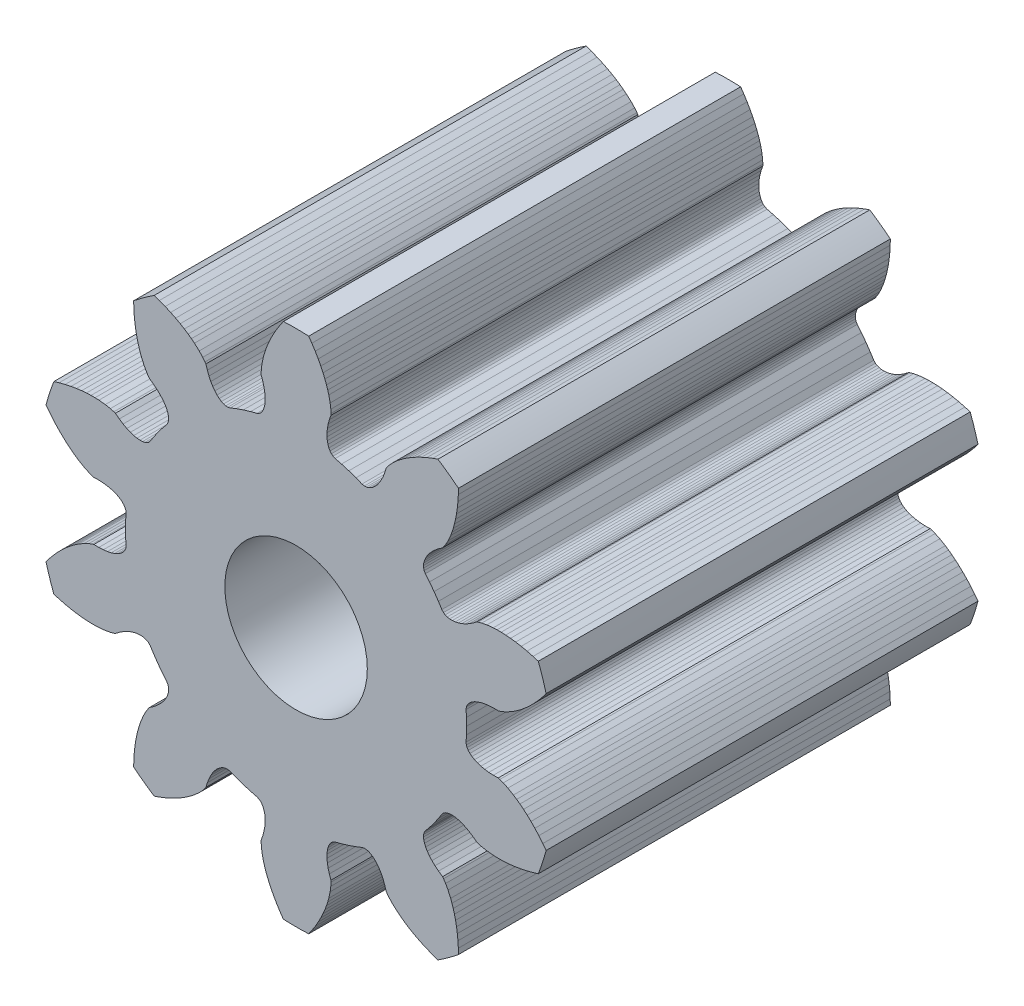
from build123d import *

# Parameters (mm, degrees)
BOSS_EXTRUDE1_DEPTH = 10
SKETCH3_R           = 1.65
CUT_EXTRUDE1_DEPTH  = 10


with BuildPart() as part:
    # Sketch1 → Boss-Extrude1 (new body)
    with BuildSketch(Plane.XY):
        with BuildLine():
            Line((11.24280794, -4.548480945), (11.251725245, -4.403945659))
            Line((11.251725245, -4.403945659), (11.265967937, -4.266876134))
            Line((11.265967937, -4.266876134), (11.28465844, -4.139331217))
            Line((11.28465844, -4.139331217), (11.307131739, -4.02085472))
            Line((11.307131739, -4.02085472), (11.33251264, -3.912045516))
            Line((11.33251264, -3.912045516), (11.360817047, -3.810271492))
            Line((11.360817047, -3.810271492), (11.389663856, -3.721119162))
            Line((11.389663856, -3.721119162), (11.420794724, -3.637118149))
            Line((11.420794724, -3.637118149), (11.480739848, -3.501552594))
            Line((11.480739848, -3.501552594), (11.537697551, -3.397143289))
            Line((11.537697551, -3.397143289), (11.584524134, -3.326188015))
            Line((11.584524134, -3.326188015), (11.607563025, -3.296396327))
            Line((11.607563025, -3.296396327), (11.7007486, -3.231659644))
            Line((11.7007486, -3.231659644), (11.782650219, -3.165257429))
            Line((11.782650219, -3.165257429), (11.853301177, -3.098018273))
            Line((11.853301177, -3.098018273), (11.912793041, -3.030765714))
            Line((11.912793041, -3.030765714), (11.961247519, -2.964313745))
            Line((11.961247519, -2.964313745), (11.998868536, -2.899453414))
            Line((11.998868536, -2.899453414), (12.025888121, -2.83698045))
            Line((12.025888121, -2.83698045), (12.042580832, -2.777647013))
            Line((12.042580832, -2.777647013), (12.049269124, -2.722220173))
            Line((12.049269124, -2.722220173), (12.046326022, -2.67141764))
            Line((12.046326022, -2.67141764), (12.034157218, -2.625933625))
            Line((12.034157218, -2.625933625), (12.00667002, -2.577586728))
            Line((12.00667002, -2.577586728), (11.910885731, -2.461743241))
            Line((11.910885731, -2.461743241), (11.804350933, -2.321745644))
            Line((11.804350933, -2.321745644), (11.704126389, -2.177163381))
            Line((11.704126389, -2.177163381), (11.623551619, -2.050269527))
            Line((11.623551619, -2.050269527), (11.586065014, -2.009187622))
            Line((11.586065014, -2.009187622), (11.546567534, -1.983559035))
            Line((11.546567534, -1.983559035), (11.499160923, -1.965061131))
            Line((11.499160923, -1.965061131), (11.44438007, -1.95429424))
            Line((11.44438007, -1.95429424), (11.382792286, -1.951834936))
            Line((11.382792286, -1.951834936), (11.31502745, -1.95822683))
            Line((11.31502745, -1.95822683), (11.241716085, -1.973963644))
            Line((11.241716085, -1.973963644), (11.163543256, -1.999511821))
            Line((11.163543256, -1.999511821), (11.081198256, -2.035309721))
            Line((11.081198256, -2.035309721), (10.995417706, -2.081724794))
            Line((10.995417706, -2.081724794), (10.906956444, -2.139098434))
            Line((10.906956444, -2.139098434), (10.816592256, -2.207718425))
            Line((10.816592256, -2.207718425), (10.781139283, -2.220423615))
            Line((10.781139283, -2.220423615), (10.699186612, -2.243032007))
            Line((10.699186612, -2.243032007), (10.582286557, -2.264937718))
            Line((10.582286557, -2.264937718), (10.434831987, -2.280056825))
            Line((10.434831987, -2.280056825), (10.34532231, -2.28370632))
            Line((10.34532231, -2.28370632), (10.251619251, -2.28359172))
            Line((10.251619251, -2.28359172), (10.146079859, -2.27906092))
            Line((10.146079859, -2.27906092), (10.034753033, -2.269575618))
            Line((10.034753033, -2.269575618), (9.915130561, -2.254337721))
            Line((9.915130561, -2.254337721), (9.788052434, -2.232700017))
            Line((9.788052434, -2.232700017), (9.653290353, -2.203888721))
            Line((9.653290353, -2.203888721), (9.513073524, -2.167705739))
            Line((9.513073524, -2.167705739), (9.391215367, -2.131083096))
            ThreePointArc((9.391215367, -2.131083096), (9.29365386, -1.854080715), (9.209763553, -1.572636258))
            Line((9.209763553, -1.572636258), (9.286815111, -1.471375772))
            Line((9.286815111, -1.471375772), (9.378985116, -1.359685766))
            Line((9.378985116, -1.359685766), (9.471075093, -1.257165792))
            Line((9.471075093, -1.257165792), (9.561165073, -1.164965812))
            Line((9.561165073, -1.164965812), (9.648985095, -1.082325791))
            Line((9.648985095, -1.082325791), (9.733475098, -1.009215789))
            Line((9.733475098, -1.009215789), (9.81619511, -0.94351578))
            Line((9.81619511, -0.94351578), (9.891935109, -0.88834578))
            Line((9.891935109, -0.88834578), (9.966495071, -0.838685805))
            Line((9.966495071, -0.838685805), (10.094675105, -0.764245785))
            Line((10.094675105, -0.764245785), (10.202125106, -0.713255785))
            Line((10.202125106, -0.713255785), (10.281715091, -0.683375791))
            Line((10.281715091, -0.683375791), (10.317865079, -0.672815794))
            Line((10.317865079, -0.672815794), (10.431305062, -0.675215794))
            Line((10.431305062, -0.675215794), (10.536595103, -0.669635792))
            Line((10.536595103, -0.669635792), (10.633275117, -0.65676579))
            Line((10.633275117, -0.65676579), (10.720935113, -0.637325791))
            Line((10.720935113, -0.637325791), (10.799195082, -0.612045801))
            Line((10.799195082, -0.612045801), (10.867755084, -0.5816858))
            Line((10.867755084, -0.5816858), (10.926335067, -0.54702581))
            Line((10.926335067, -0.54702581), (10.974715085, -0.508835796))
            Line((10.974715085, -0.508835796), (11.012705082, -0.467925798))
            Line((11.012705082, -0.467925798), (11.040185082, -0.425095799))
            Line((11.040185082, -0.425095799), (11.057075085, -0.381145791))
            Line((11.057075085, -0.381145791), (11.063255088, -0.325875762))
            Line((11.063255088, -0.325875762), (11.053855092, -0.175855818))
            Line((11.053855092, -0.175855818), (11.049955091, 2.4198e-05))
            Line((11.049955091, 2.4198e-05), (11.053855092, 0.175904215))
            Line((11.053855092, 0.175904215), (11.063255088, 0.325924159))
            Line((11.063255088, 0.325924159), (11.057075085, 0.381194188))
            Line((11.057075085, 0.381194188), (11.040185082, 0.425144195))
            Line((11.040185082, 0.425144195), (11.012705082, 0.467974195))
            Line((11.012705082, 0.467974195), (10.974715085, 0.508884192))
            Line((10.974715085, 0.508884192), (10.926335067, 0.547074206))
            Line((10.926335067, 0.547074206), (10.867755084, 0.581734196))
            Line((10.867755084, 0.581734196), (10.799195082, 0.612094197))
            Line((10.799195082, 0.612094197), (10.720935113, 0.637374187))
            Line((10.720935113, 0.637374187), (10.633275117, 0.656814186))
            Line((10.633275117, 0.656814186), (10.536595103, 0.669684188))
            Line((10.536595103, 0.669684188), (10.431305062, 0.67526419))
            Line((10.431305062, 0.67526419), (10.317865079, 0.672864191))
            Line((10.317865079, 0.672864191), (10.281715091, 0.683424187))
            Line((10.281715091, 0.683424187), (10.202125106, 0.713304181))
            Line((10.202125106, 0.713304181), (10.094675105, 0.764294182))
            Line((10.094675105, 0.764294182), (9.966495071, 0.838734202))
            Line((9.966495071, 0.838734202), (9.891935109, 0.888394177))
            Line((9.891935109, 0.888394177), (9.81619511, 0.943564176))
            Line((9.81619511, 0.943564176), (9.733475098, 1.009264185))
            Line((9.733475098, 1.009264185), (9.648985095, 1.082374188))
            Line((9.648985095, 1.082374188), (9.561165073, 1.165014209))
            Line((9.561165073, 1.165014209), (9.471075093, 1.257214188))
            Line((9.471075093, 1.257214188), (9.378985116, 1.359734163))
            Line((9.378985116, 1.359734163), (9.286815111, 1.471424169))
            Line((9.286815111, 1.471424169), (9.209756475, 1.572679268))
            ThreePointArc((9.209756475, 1.572679268), (9.293642212, 1.854113936), (9.391198182, 2.131106937))
            Line((9.391198182, 2.131106937), (9.51305364, 2.167738561))
            Line((9.51305364, 2.167738561), (9.653270469, 2.203921543))
            Line((9.653270469, 2.203921543), (9.788032549, 2.232732839))
            Line((9.788032549, 2.232732839), (9.915110676, 2.254370543))
            Line((9.915110676, 2.254370543), (10.034733149, 2.26960844))
            Line((10.034733149, 2.26960844), (10.146059975, 2.279093742))
            Line((10.146059975, 2.279093742), (10.251599367, 2.283624542))
            Line((10.251599367, 2.283624542), (10.345302425, 2.283739142))
            Line((10.345302425, 2.283739142), (10.434812103, 2.280089647))
            Line((10.434812103, 2.280089647), (10.582266673, 2.26497054))
            Line((10.582266673, 2.26497054), (10.699166728, 2.243064829))
            Line((10.699166728, 2.243064829), (10.781119399, 2.220456437))
            Line((10.781119399, 2.220456437), (10.816572372, 2.207751247))
            Line((10.816572372, 2.207751247), (10.90693656, 2.139131256))
            Line((10.90693656, 2.139131256), (10.995397821, 2.081757616))
            Line((10.995397821, 2.081757616), (11.081178372, 2.035342543))
            Line((11.081178372, 2.035342543), (11.163523371, 1.999544643))
            Line((11.163523371, 1.999544643), (11.241696201, 1.973996466))
            Line((11.241696201, 1.973996466), (11.315007566, 1.958259652))
            Line((11.315007566, 1.958259652), (11.382772401, 1.951867758))
            Line((11.382772401, 1.951867758), (11.444360185, 1.954327062))
            Line((11.444360185, 1.954327062), (11.499141039, 1.965093953))
            Line((11.499141039, 1.965093953), (11.54654765, 1.983591857))
            Line((11.54654765, 1.983591857), (11.58604513, 2.009220444))
            Line((11.58604513, 2.009220444), (11.623531735, 2.050302349))
            Line((11.623531735, 2.050302349), (11.704106505, 2.177196202))
            Line((11.704106505, 2.177196202), (11.804331049, 2.321778466))
            Line((11.804331049, 2.321778466), (11.910865847, 2.461776063))
            Line((11.910865847, 2.461776063), (12.006650136, 2.57761955))
            Line((12.006650136, 2.57761955), (12.034137334, 2.625966447))
            Line((12.034137334, 2.625966447), (12.046306138, 2.671450462))
            Line((12.046306138, 2.671450462), (12.04924924, 2.722252995))
            Line((12.04924924, 2.722252995), (12.042560947, 2.777679835))
            Line((12.042560947, 2.777679835), (12.025868237, 2.837013272))
            Line((12.025868237, 2.837013272), (11.998848652, 2.899486236))
            Line((11.998848652, 2.899486236), (11.961227634, 2.964346567))
            Line((11.961227634, 2.964346567), (11.912773157, 3.030798536))
            Line((11.912773157, 3.030798536), (11.853281293, 3.098051095))
            Line((11.853281293, 3.098051095), (11.782630335, 3.165290251))
            Line((11.782630335, 3.165290251), (11.700728716, 3.231692466))
            Line((11.700728716, 3.231692466), (11.60754314, 3.296429149))
            Line((11.60754314, 3.296429149), (11.58450425, 3.326220837))
            Line((11.58450425, 3.326220837), (11.537677667, 3.397176111))
            Line((11.537677667, 3.397176111), (11.480719964, 3.501585416))
            Line((11.480719964, 3.501585416), (11.42077484, 3.637150971))
            Line((11.42077484, 3.637150971), (11.389643972, 3.721151984))
            Line((11.389643972, 3.721151984), (11.360797162, 3.810304314))
            Line((11.360797162, 3.810304314), (11.332492756, 3.912078338))
            Line((11.332492756, 3.912078338), (11.307111855, 4.020887542))
            Line((11.307111855, 4.020887542), (11.284638555, 4.139364039))
            Line((11.284638555, 4.139364039), (11.265948053, 4.266908956))
            Line((11.265948053, 4.266908956), (11.251705361, 4.403978481))
            Line((11.251705361, 4.403978481), (11.242788055, 4.548513767))
            Line((11.242788055, 4.548513767), (11.239945539, 4.675724414))
            ThreePointArc((11.239945539, 4.675724414), (11.473253394, 4.854119255), (11.715011432, 5.020883537))
            Line((11.715011432, 5.020883537), (11.835126141, 4.978894429))
            Line((11.835126141, 4.978894429), (11.969831737, 4.925749631))
            Line((11.969831737, 4.925749631), (12.095791424, 4.869847337))
            Line((12.095791424, 4.869847337), (12.211318145, 4.812658026))
            Line((12.211318145, 4.812658026), (12.317051325, 4.754673337))
            Line((12.317051325, 4.754673337), (12.412691934, 4.696910832))
            Line((12.412691934, 4.696910832), (12.500738235, 4.638541831))
            Line((12.500738235, 4.638541831), (12.576612982, 4.583557297))
            Line((12.576612982, 4.583557297), (12.646882726, 4.527992341))
            Line((12.646882726, 4.527992341), (12.757289225, 4.429089142))
            Line((12.757289225, 4.429089142), (12.838987421, 4.342654846))
            Line((12.838987421, 4.342654846), (12.891999653, 4.276193707))
            Line((12.891999653, 4.276193707), (12.913213808, 4.245076272))
            Line((12.913213808, 4.245076272), (12.945986105, 4.136446782))
            Line((12.945986105, 4.136446782), (12.983829429, 4.038034322))
            Line((12.983829429, 4.038034322), (13.025945325, 3.950063229))
            Line((13.025945325, 3.950063229), (13.071522251, 3.872700884))
            Line((13.071522251, 3.872700884), (13.119748593, 3.806083165))
            Line((13.119748593, 3.806083165), (13.169808925, 3.750260529))
            Line((13.169808925, 3.750260529), (13.22087471, 3.705258142))
            Line((13.22087471, 3.705258142), (13.272145802, 3.671047347))
            Line((13.272145802, 3.671047347), (13.322793101, 3.647558648))
            Line((13.322793101, 3.647558648), (13.372018644, 3.634658837))
            Line((13.372018644, 3.634658837), (13.41903688, 3.63217674))
            Line((13.41903688, 3.63217674), (13.473511535, 3.643378551))
            Line((13.473511535, 3.643378551), (13.613284203, 3.698677239))
            Line((13.613284203, 3.698677239), (13.779350886, 3.756736233))
            Line((13.779350886, 3.756736233), (13.947827886, 3.807377033))
            Line((13.947827886, 3.807377033), (14.093410086, 3.844795833))
            Line((14.093410086, 3.844795833), (14.144065286, 3.867752733))
            Line((14.144065286, 3.867752733), (14.180644886, 3.897397433))
            Line((14.180644886, 3.897397433), (14.212886886, 3.936767633))
            Line((14.212886886, 3.936767633), (14.240055086, 3.985540133))
            Line((14.240055086, 3.985540133), (14.261425686, 4.043353633))
            Line((14.261425686, 4.043353633), (14.276287086, 4.109777033))
            Line((14.276287086, 4.109777033), (14.283974886, 4.184363233))
            Line((14.283974886, 4.184363233), (14.283833986, 4.266604833))
            Line((14.283833986, 4.266604833), (14.275234086, 4.355981733))
            Line((14.275234086, 4.355981733), (14.257598386, 4.451906933))
            Line((14.257598386, 4.451906933), (14.230368886, 4.553768033))
            Line((14.230368886, 4.553768033), (14.193031486, 4.660914233))
            Line((14.193031486, 4.660914233), (14.191903686, 4.698558133))
            Line((14.191903686, 4.698558133), (14.195726586, 4.783486133))
            Line((14.195726586, 4.783486133), (14.211017086, 4.901433933))
            Line((14.211017086, 4.901433933), (14.242203886, 5.046343633))
            Line((14.242203886, 5.046343633), (14.266393086, 5.132600133))
            Line((14.266393086, 5.132600133), (14.295457886, 5.221681633))
            Line((14.295457886, 5.221681633), (14.332380486, 5.320655433))
            Line((14.332380486, 5.320655433), (14.375803386, 5.423602433))
            Line((14.375803386, 5.423602433), (14.427260786, 5.532661433))
            Line((14.427260786, 5.532661433), (14.487108886, 5.646833433))
            Line((14.487108886, 5.646833433), (14.556153786, 5.766096633))
            Line((14.556153786, 5.766096633), (14.633895186, 5.888269633))
            Line((14.633895186, 5.888269633), (14.706381822, 5.992846477))
            ThreePointArc((14.706381822, 5.992846477), (14.999974513, 6.000034529), (15.293567239, 5.992847859))
            Line((15.293567239, 5.992847859), (15.366061423, 5.888276248))
            Line((15.366061423, 5.888276248), (15.443802823, 5.766103248))
            Line((15.443802823, 5.766103248), (15.512847723, 5.646840048))
            Line((15.512847723, 5.646840048), (15.572695823, 5.532668048))
            Line((15.572695823, 5.532668048), (15.624153223, 5.423609048))
            Line((15.624153223, 5.423609048), (15.667576123, 5.320662048))
            Line((15.667576123, 5.320662048), (15.704498723, 5.221688248))
            Line((15.704498723, 5.221688248), (15.733563523, 5.132606748))
            Line((15.733563523, 5.132606748), (15.757752723, 5.046350248))
            Line((15.757752723, 5.046350248), (15.788939523, 4.901440548))
            Line((15.788939523, 4.901440548), (15.804230023, 4.783492748))
            Line((15.804230023, 4.783492748), (15.808052923, 4.698564748))
            Line((15.808052923, 4.698564748), (15.806925123, 4.660920848))
            Line((15.806925123, 4.660920848), (15.769587723, 4.553774648))
            Line((15.769587723, 4.553774648), (15.742358223, 4.451913548))
            Line((15.742358223, 4.451913548), (15.724722523, 4.355988348))
            Line((15.724722523, 4.355988348), (15.716122623, 4.266611448))
            Line((15.716122623, 4.266611448), (15.715981723, 4.184369848))
            Line((15.715981723, 4.184369848), (15.723669523, 4.109783648))
            Line((15.723669523, 4.109783648), (15.738530923, 4.043360248))
            Line((15.738530923, 4.043360248), (15.759901523, 3.985546748))
            Line((15.759901523, 3.985546748), (15.787069723, 3.936774248))
            Line((15.787069723, 3.936774248), (15.819311723, 3.897404048))
            Line((15.819311723, 3.897404048), (15.855891323, 3.867759348))
            Line((15.855891323, 3.867759348), (15.906546523, 3.844802448))
            Line((15.906546523, 3.844802448), (16.052128723, 3.807383648))
            Line((16.052128723, 3.807383648), (16.220605723, 3.756742848))
            Line((16.220605723, 3.756742848), (16.386672406, 3.698683854))
            Line((16.386672406, 3.698683854), (16.526445074, 3.643385166))
            Line((16.526445074, 3.643385166), (16.580919729, 3.632183355))
            Line((16.580919729, 3.632183355), (16.627937965, 3.634665452))
            Line((16.627937965, 3.634665452), (16.677163508, 3.647565263))
            Line((16.677163508, 3.647565263), (16.727810807, 3.671053962))
            Line((16.727810807, 3.671053962), (16.779081898, 3.705264757))
            Line((16.779081898, 3.705264757), (16.830147684, 3.750267144))
            Line((16.830147684, 3.750267144), (16.880208016, 3.80608978))
            Line((16.880208016, 3.80608978), (16.928434358, 3.872707499))
            Line((16.928434358, 3.872707499), (16.974011284, 3.950069844))
            Line((16.974011284, 3.950069844), (17.01612718, 4.038040937))
            Line((17.01612718, 4.038040937), (17.053970503, 4.136453396))
            Line((17.053970503, 4.136453396), (17.086742801, 4.245082887))
            Line((17.086742801, 4.245082887), (17.107956956, 4.276200321))
            Line((17.107956956, 4.276200321), (17.160969188, 4.342661461))
            Line((17.160969188, 4.342661461), (17.242667384, 4.429095757))
            Line((17.242667384, 4.429095757), (17.353073883, 4.527998956))
            Line((17.353073883, 4.527998956), (17.423343627, 4.583563912))
            Line((17.423343627, 4.583563912), (17.499218374, 4.638548446))
            Line((17.499218374, 4.638548446), (17.587264675, 4.696917447))
            Line((17.587264675, 4.696917447), (17.682905284, 4.754679952))
            Line((17.682905284, 4.754679952), (17.788638464, 4.812664641))
            Line((17.788638464, 4.812664641), (17.904165185, 4.869853952))
            Line((17.904165185, 4.869853952), (18.030124872, 4.925756246))
            Line((18.030124872, 4.925756246), (18.164830468, 4.978901044))
            Line((18.164830468, 4.978901044), (18.284942048, 5.020899103))
            ThreePointArc((18.284942048, 5.020899103), (18.526688607, 4.85414488), (18.759985941, 4.675761237))
            Line((18.759985941, 4.675761237), (18.757169332, 4.548550014))
            Line((18.757169332, 4.548550014), (18.748252027, 4.404014728))
            Line((18.748252027, 4.404014728), (18.734009334, 4.266945203))
            Line((18.734009334, 4.266945203), (18.715318832, 4.139400286))
            Line((18.715318832, 4.139400286), (18.692845533, 4.020923789))
            Line((18.692845533, 4.020923789), (18.667464632, 3.912114585))
            Line((18.667464632, 3.912114585), (18.639160225, 3.810340561))
            Line((18.639160225, 3.810340561), (18.610313415, 3.721188232))
            Line((18.610313415, 3.721188232), (18.579182547, 3.637187218))
            Line((18.579182547, 3.637187218), (18.519237423, 3.501621663))
            Line((18.519237423, 3.501621663), (18.46227972, 3.397212358))
            Line((18.46227972, 3.397212358), (18.415453138, 3.326257084))
            Line((18.415453138, 3.326257084), (18.392414247, 3.296465396))
            Line((18.392414247, 3.296465396), (18.299228671, 3.231728713))
            Line((18.299228671, 3.231728713), (18.217327053, 3.165326498))
            Line((18.217327053, 3.165326498), (18.146676094, 3.098087343))
            Line((18.146676094, 3.098087343), (18.087184231, 3.030834784))
            Line((18.087184231, 3.030834784), (18.038729753, 2.964382814))
            Line((18.038729753, 2.964382814), (18.001108735, 2.899522483))
            Line((18.001108735, 2.899522483), (17.974089151, 2.837049519))
            Line((17.974089151, 2.837049519), (17.95739644, 2.777716082))
            Line((17.95739644, 2.777716082), (17.950708147, 2.722289242))
            Line((17.950708147, 2.722289242), (17.953651249, 2.671486709))
            Line((17.953651249, 2.671486709), (17.965820053, 2.626002694))
            Line((17.965820053, 2.626002694), (17.993307252, 2.577655797))
            Line((17.993307252, 2.577655797), (18.089091541, 2.46181231))
            Line((18.089091541, 2.46181231), (18.195626338, 2.321814713))
            Line((18.195626338, 2.321814713), (18.295850882, 2.17723245))
            Line((18.295850882, 2.17723245), (18.376425653, 2.050338597))
            Line((18.376425653, 2.050338597), (18.413912258, 2.009256691))
            Line((18.413912258, 2.009256691), (18.453409738, 1.983628104))
            Line((18.453409738, 1.983628104), (18.500816348, 1.9651302))
            Line((18.500816348, 1.9651302), (18.555597202, 1.954363309))
            Line((18.555597202, 1.954363309), (18.617184986, 1.951904006))
            Line((18.617184986, 1.951904006), (18.684949822, 1.9582959))
            Line((18.684949822, 1.9582959), (18.758261186, 1.974032713))
            Line((18.758261186, 1.974032713), (18.836434016, 1.99958089))
            Line((18.836434016, 1.99958089), (18.918779015, 2.03537879))
            Line((18.918779015, 2.03537879), (19.004559566, 2.081793863))
            Line((19.004559566, 2.081793863), (19.093020828, 2.139167503))
            Line((19.093020828, 2.139167503), (19.183385016, 2.207787494))
            Line((19.183385016, 2.207787494), (19.218837988, 2.220492685))
            Line((19.218837988, 2.220492685), (19.30079066, 2.243101077))
            Line((19.30079066, 2.243101077), (19.417690714, 2.265006787))
            Line((19.417690714, 2.265006787), (19.565145285, 2.280125894))
            Line((19.565145285, 2.280125894), (19.654654962, 2.283775389))
            Line((19.654654962, 2.283775389), (19.74835802, 2.283660789))
            Line((19.74835802, 2.283660789), (19.853897413, 2.279129989))
            Line((19.853897413, 2.279129989), (19.965224238, 2.269644687))
            Line((19.965224238, 2.269644687), (20.084846711, 2.254406791))
            Line((20.084846711, 2.254406791), (20.211924838, 2.232769086))
            Line((20.211924838, 2.232769086), (20.346686919, 2.20395779))
            Line((20.346686919, 2.20395779), (20.486903747, 2.167774809))
            Line((20.486903747, 2.167774809), (20.608761905, 2.131152165))
            ThreePointArc((20.608761905, 2.131152165), (20.706323412, 1.854149785), (20.790213719, 1.572705327))
            Line((20.790213719, 1.572705327), (20.713162161, 1.471444842))
            Line((20.713162161, 1.471444842), (20.620992156, 1.359754836))
            Line((20.620992156, 1.359754836), (20.528902179, 1.257234861))
            Line((20.528902179, 1.257234861), (20.438812199, 1.165034882))
            Line((20.438812199, 1.165034882), (20.350992176, 1.08239486))
            Line((20.350992176, 1.08239486), (20.266502173, 1.009284858))
            Line((20.266502173, 1.009284858), (20.183782162, 0.943584849))
            Line((20.183782162, 0.943584849), (20.108042163, 0.88841485))
            Line((20.108042163, 0.88841485), (20.0334822, 0.838754874))
            Line((20.0334822, 0.838754874), (19.905302166, 0.764314855))
            Line((19.905302166, 0.764314855), (19.797852165, 0.713324854))
            Line((19.797852165, 0.713324854), (19.71826218, 0.68344486))
            Line((19.71826218, 0.68344486), (19.682112193, 0.672884863))
            Line((19.682112193, 0.672884863), (19.56867221, 0.675284863))
            Line((19.56867221, 0.675284863), (19.463382168, 0.669704861))
            Line((19.463382168, 0.669704861), (19.366702155, 0.656834859))
            Line((19.366702155, 0.656834859), (19.279042159, 0.63739486))
            Line((19.279042159, 0.63739486), (19.20078219, 0.61211487))
            Line((19.20078219, 0.61211487), (19.132222188, 0.581754869))
            Line((19.132222188, 0.581754869), (19.073642205, 0.547094879))
            Line((19.073642205, 0.547094879), (19.025262187, 0.508904865))
            Line((19.025262187, 0.508904865), (18.987272189, 0.467994867))
            Line((18.987272189, 0.467994867), (18.95979219, 0.425164868))
            Line((18.95979219, 0.425164868), (18.942902187, 0.38121486))
            Line((18.942902187, 0.38121486), (18.936722183, 0.325944831))
            Line((18.936722183, 0.325944831), (18.94612218, 0.175924887))
            Line((18.94612218, 0.175924887), (18.95002218, 4.4871e-05))
            Line((18.95002218, 4.4871e-05), (18.94612218, -0.175835145))
            Line((18.94612218, -0.175835145), (18.936722183, -0.325855089))
            Line((18.936722183, -0.325855089), (18.942902187, -0.381125118))
            Line((18.942902187, -0.381125118), (18.95979219, -0.425075126))
            Line((18.95979219, -0.425075126), (18.987272189, -0.467905125))
            Line((18.987272189, -0.467905125), (19.025262187, -0.508815123))
            Line((19.025262187, -0.508815123), (19.073642205, -0.547005137))
            Line((19.073642205, -0.547005137), (19.132222188, -0.581665127))
            Line((19.132222188, -0.581665127), (19.20078219, -0.612025128))
            Line((19.20078219, -0.612025128), (19.279042159, -0.637305118))
            Line((19.279042159, -0.637305118), (19.366702155, -0.656745117))
            Line((19.366702155, -0.656745117), (19.463382168, -0.669615119))
            Line((19.463382168, -0.669615119), (19.56867221, -0.675195121))
            Line((19.56867221, -0.675195121), (19.682112193, -0.672795121))
            Line((19.682112193, -0.672795121), (19.71826218, -0.683355118))
            Line((19.71826218, -0.683355118), (19.797852165, -0.713235112))
            Line((19.797852165, -0.713235112), (19.905302166, -0.764225113))
            Line((19.905302166, -0.764225113), (20.0334822, -0.838665132))
            Line((20.0334822, -0.838665132), (20.108042163, -0.888325108))
            Line((20.108042163, -0.888325108), (20.183782162, -0.943495107))
            Line((20.183782162, -0.943495107), (20.266502173, -1.009195116))
            Line((20.266502173, -1.009195116), (20.350992176, -1.082305118))
            Line((20.350992176, -1.082305118), (20.438812199, -1.16494514))
            Line((20.438812199, -1.16494514), (20.528902179, -1.257145119))
            Line((20.528902179, -1.257145119), (20.620992156, -1.359665094))
            Line((20.620992156, -1.359665094), (20.713162161, -1.471355099))
            Line((20.713162161, -1.471355099), (20.790220797, -1.572610199))
            ThreePointArc((20.790220797, -1.572610199), (20.706335059, -1.854044867), (20.608779089, -2.131037867))
            Line((20.608779089, -2.131037867), (20.486923632, -2.167669492))
            Line((20.486923632, -2.167669492), (20.346706803, -2.203852474))
            Line((20.346706803, -2.203852474), (20.211944722, -2.23266377))
            Line((20.211944722, -2.23266377), (20.084866595, -2.254301474))
            Line((20.084866595, -2.254301474), (19.965244122, -2.269539371))
            Line((19.965244122, -2.269539371), (19.853917297, -2.279024673))
            Line((19.853917297, -2.279024673), (19.748377905, -2.283555473))
            Line((19.748377905, -2.283555473), (19.654674846, -2.283670073))
            Line((19.654674846, -2.283670073), (19.565165169, -2.280020578))
            Line((19.565165169, -2.280020578), (19.417710599, -2.26490147))
            Line((19.417710599, -2.26490147), (19.300810544, -2.24299576))
            Line((19.300810544, -2.24299576), (19.218857873, -2.220387368))
            Line((19.218857873, -2.220387368), (19.1834049, -2.207682178))
            Line((19.1834049, -2.207682178), (19.093040712, -2.139062187))
            Line((19.093040712, -2.139062187), (19.00457945, -2.081688547))
            Line((19.00457945, -2.081688547), (18.9187989, -2.035273474))
            Line((18.9187989, -2.035273474), (18.8364539, -1.999475574))
            Line((18.8364539, -1.999475574), (18.758281071, -1.973927397))
            Line((18.758281071, -1.973927397), (18.684969706, -1.958190583))
            Line((18.684969706, -1.958190583), (18.61720487, -1.951798689))
            Line((18.61720487, -1.951798689), (18.555617086, -1.954257993))
            Line((18.555617086, -1.954257993), (18.500836233, -1.965024883))
            Line((18.500836233, -1.965024883), (18.453429622, -1.983522788))
            Line((18.453429622, -1.983522788), (18.413932142, -2.009151374))
            Line((18.413932142, -2.009151374), (18.376445537, -2.05023328))
            Line((18.376445537, -2.05023328), (18.295870767, -2.177127133))
            Line((18.295870767, -2.177127133), (18.195646223, -2.321709397))
            Line((18.195646223, -2.321709397), (18.089111425, -2.461706993))
            Line((18.089111425, -2.461706993), (17.993327136, -2.57755048))
            Line((17.993327136, -2.57755048), (17.965839937, -2.625897378))
            Line((17.965839937, -2.625897378), (17.953671134, -2.671381392))
            Line((17.953671134, -2.671381392), (17.950728032, -2.722183925))
            Line((17.950728032, -2.722183925), (17.957416324, -2.777610765))
            Line((17.957416324, -2.777610765), (17.974109035, -2.836944202))
            Line((17.974109035, -2.836944202), (18.00112862, -2.899417167))
            Line((18.00112862, -2.899417167), (18.038749637, -2.964277498))
            Line((18.038749637, -2.964277498), (18.087204115, -3.030729467))
            Line((18.087204115, -3.030729467), (18.146695979, -3.097982026))
            Line((18.146695979, -3.097982026), (18.217346937, -3.165221181))
            Line((18.217346937, -3.165221181), (18.299248556, -3.231623397))
            Line((18.299248556, -3.231623397), (18.392434131, -3.29636008))
            Line((18.392434131, -3.29636008), (18.415473022, -3.326151768))
            Line((18.415473022, -3.326151768), (18.462299605, -3.397107041))
            Line((18.462299605, -3.397107041), (18.519257307, -3.501516347))
            Line((18.519257307, -3.501516347), (18.579202432, -3.637081902))
            Line((18.579202432, -3.637081902), (18.6103333, -3.721082915))
            Line((18.6103333, -3.721082915), (18.639180109, -3.810235244))
            Line((18.639180109, -3.810235244), (18.667484516, -3.912009269))
            Line((18.667484516, -3.912009269), (18.692865417, -4.020818473))
            Line((18.692865417, -4.020818473), (18.715338716, -4.13929497))
            Line((18.715338716, -4.13929497), (18.734029219, -4.266839886))
            Line((18.734029219, -4.266839886), (18.748271911, -4.403909412))
            Line((18.748271911, -4.403909412), (18.757189216, -4.548444698))
            Line((18.757189216, -4.548444698), (18.760031732, -4.675655345))
            ThreePointArc((18.760031732, -4.675655345), (18.526719393, -4.854053443), (18.284956564, -5.020820536))
            Line((18.284956564, -5.020820536), (18.164841855, -4.978831429))
            Line((18.164841855, -4.978831429), (18.030136259, -4.92568663))
            Line((18.030136259, -4.92568663), (17.904176572, -4.869784336))
            Line((17.904176572, -4.869784336), (17.788649851, -4.812595026))
            Line((17.788649851, -4.812595026), (17.682916671, -4.754610337))
            Line((17.682916671, -4.754610337), (17.587276062, -4.696847832))
            Line((17.587276062, -4.696847832), (17.49922976, -4.638478831))
            Line((17.49922976, -4.638478831), (17.423355013, -4.583494296))
            Line((17.423355013, -4.583494296), (17.35308527, -4.527929341))
            Line((17.35308527, -4.527929341), (17.242678771, -4.429026142))
            Line((17.242678771, -4.429026142), (17.160980574, -4.342591846))
            Line((17.160980574, -4.342591846), (17.107968343, -4.276130706))
            Line((17.107968343, -4.276130706), (17.086754187, -4.245013271))
            Line((17.086754187, -4.245013271), (17.05398189, -4.136383781))
            Line((17.05398189, -4.136383781), (17.016138567, -4.037971321))
            Line((17.016138567, -4.037971321), (16.974022671, -3.950000228))
            Line((16.974022671, -3.950000228), (16.928445745, -3.872637884))
            Line((16.928445745, -3.872637884), (16.880219403, -3.806020164))
            Line((16.880219403, -3.806020164), (16.830159071, -3.750197529))
            Line((16.830159071, -3.750197529), (16.779093285, -3.705195142))
            Line((16.779093285, -3.705195142), (16.727822193, -3.670984347))
            Line((16.727822193, -3.670984347), (16.677174895, -3.647495648))
            Line((16.677174895, -3.647495648), (16.627949352, -3.634595836))
            Line((16.627949352, -3.634595836), (16.580931115, -3.63211374))
            Line((16.580931115, -3.63211374), (16.526456461, -3.643315551))
            Line((16.526456461, -3.643315551), (16.386683793, -3.698614238))
            Line((16.386683793, -3.698614238), (16.220617109, -3.756673233))
            Line((16.220617109, -3.756673233), (16.052140109, -3.807314033))
            Line((16.052140109, -3.807314033), (15.906557909, -3.844732833))
            Line((15.906557909, -3.844732833), (15.855902709, -3.867689733))
            Line((15.855902709, -3.867689733), (15.819323109, -3.897334433))
            Line((15.819323109, -3.897334433), (15.787081109, -3.936704633))
            Line((15.787081109, -3.936704633), (15.759912909, -3.985477133))
            Line((15.759912909, -3.985477133), (15.738542309, -4.043290633))
            Line((15.738542309, -4.043290633), (15.723680909, -4.109714033))
            Line((15.723680909, -4.109714033), (15.715993109, -4.184300233))
            Line((15.715993109, -4.184300233), (15.716134009, -4.266541833))
            Line((15.716134009, -4.266541833), (15.724733909, -4.355918733))
            Line((15.724733909, -4.355918733), (15.742369609, -4.451843933))
            Line((15.742369609, -4.451843933), (15.769599109, -4.553705033))
            Line((15.769599109, -4.553705033), (15.806936509, -4.660851233))
            Line((15.806936509, -4.660851233), (15.808064309, -4.698495133))
            Line((15.808064309, -4.698495133), (15.804241409, -4.783423133))
            Line((15.804241409, -4.783423133), (15.788950909, -4.901370933))
            Line((15.788950909, -4.901370933), (15.757764109, -5.046280633))
            Line((15.757764109, -5.046280633), (15.733574909, -5.132537133))
            Line((15.733574909, -5.132537133), (15.704510109, -5.221618633))
            Line((15.704510109, -5.221618633), (15.667587509, -5.320592433))
            Line((15.667587509, -5.320592433), (15.624164609, -5.423539433))
            Line((15.624164609, -5.423539433), (15.572707209, -5.532598433))
            Line((15.572707209, -5.532598433), (15.512859109, -5.646770433))
            Line((15.512859109, -5.646770433), (15.443814209, -5.766033633))
            Line((15.443814209, -5.766033633), (15.366072809, -5.888206633))
            Line((15.366072809, -5.888206633), (15.293578609, -5.992778233))
            ThreePointArc((15.293578609, -5.992778233), (14.999964402, -5.99996546), (14.706350252, -5.992775861))
            Line((14.706350252, -5.992775861), (14.633877797, -5.88818919))
            Line((14.633877797, -5.88818919), (14.556136397, -5.76601619))
            Line((14.556136397, -5.76601619), (14.487091497, -5.64675299))
            Line((14.487091497, -5.64675299), (14.427243397, -5.53258099))
            Line((14.427243397, -5.53258099), (14.375785997, -5.42352199))
            Line((14.375785997, -5.42352199), (14.332363097, -5.32057499))
            Line((14.332363097, -5.32057499), (14.295440497, -5.22160119))
            Line((14.295440497, -5.22160119), (14.266375697, -5.13251969))
            Line((14.266375697, -5.13251969), (14.242186497, -5.04626319))
            Line((14.242186497, -5.04626319), (14.210999697, -4.90135349))
            Line((14.210999697, -4.90135349), (14.195709197, -4.78340569))
            Line((14.195709197, -4.78340569), (14.191886297, -4.69847769))
            Line((14.191886297, -4.69847769), (14.193014097, -4.66083379))
            Line((14.193014097, -4.66083379), (14.230351497, -4.55368759))
            Line((14.230351497, -4.55368759), (14.257580997, -4.45182649))
            Line((14.257580997, -4.45182649), (14.275216697, -4.35590129))
            Line((14.275216697, -4.35590129), (14.283816597, -4.26652439))
            Line((14.283816597, -4.26652439), (14.283957497, -4.18428279))
            Line((14.283957497, -4.18428279), (14.276269697, -4.10969659))
            Line((14.276269697, -4.10969659), (14.261408297, -4.04327319))
            Line((14.261408297, -4.04327319), (14.240037697, -3.98545969))
            Line((14.240037697, -3.98545969), (14.212869497, -3.93668719))
            Line((14.212869497, -3.93668719), (14.180627497, -3.89731699))
            Line((14.180627497, -3.89731699), (14.144047897, -3.86767229))
            Line((14.144047897, -3.86767229), (14.093392697, -3.84471539))
            Line((14.093392697, -3.84471539), (13.947810497, -3.80729659))
            Line((13.947810497, -3.80729659), (13.779333497, -3.75665579))
            Line((13.779333497, -3.75665579), (13.613266814, -3.698596795))
            Line((13.613266814, -3.698596795), (13.473494146, -3.643298108))
            Line((13.473494146, -3.643298108), (13.419019491, -3.632096297))
            Line((13.419019491, -3.632096297), (13.372001255, -3.634578393))
            Line((13.372001255, -3.634578393), (13.322775712, -3.647478205))
            Line((13.322775712, -3.647478205), (13.272128413, -3.670966904))
            Line((13.272128413, -3.670966904), (13.220857321, -3.705177699))
            Line((13.220857321, -3.705177699), (13.169791536, -3.750180086))
            Line((13.169791536, -3.750180086), (13.119731204, -3.806002721))
            Line((13.119731204, -3.806002721), (13.071504862, -3.872620441))
            Line((13.071504862, -3.872620441), (13.025927936, -3.949982785))
            Line((13.025927936, -3.949982785), (12.98381204, -4.037953878))
            Line((12.98381204, -4.037953878), (12.945968716, -4.136366338))
            Line((12.945968716, -4.136366338), (12.913196419, -4.244995828))
            Line((12.913196419, -4.244995828), (12.891982264, -4.276113263))
            Line((12.891982264, -4.276113263), (12.838970032, -4.342574403))
            Line((12.838970032, -4.342574403), (12.757271836, -4.429008699))
            Line((12.757271836, -4.429008699), (12.646865337, -4.527911898))
            Line((12.646865337, -4.527911898), (12.576595593, -4.583476853))
            Line((12.576595593, -4.583476853), (12.500720846, -4.638461388))
            Line((12.500720846, -4.638461388), (12.412674545, -4.696830389))
            Line((12.412674545, -4.696830389), (12.317033936, -4.754592894))
            Line((12.317033936, -4.754592894), (12.211300756, -4.812577583))
            Line((12.211300756, -4.812577583), (12.095774035, -4.869766893))
            Line((12.095774035, -4.869766893), (11.969814348, -4.925669187))
            Line((11.969814348, -4.925669187), (11.835108752, -4.978813986))
            Line((11.835108752, -4.978813986), (11.714994041, -5.02080309))
            ThreePointArc((11.714994041, -5.02080309), (11.473268757, -4.854061347), (11.239991331, -4.675692168))
            Line((11.239991331, -4.675692168), (11.24280794, -4.548480945))
        make_face()
    extrude(amount=BOSS_EXTRUDE1_DEPTH)

    # Sketch3 → Cut-Extrude1 (cut)
    with BuildSketch(Plane.XY.offset(10)):
        with Locations((14.999988775, 3.4425e-05)):
            Circle(SKETCH3_R)
    extrude(amount=-CUT_EXTRUDE1_DEPTH, mode=Mode.SUBTRACT)


solid = part.part
